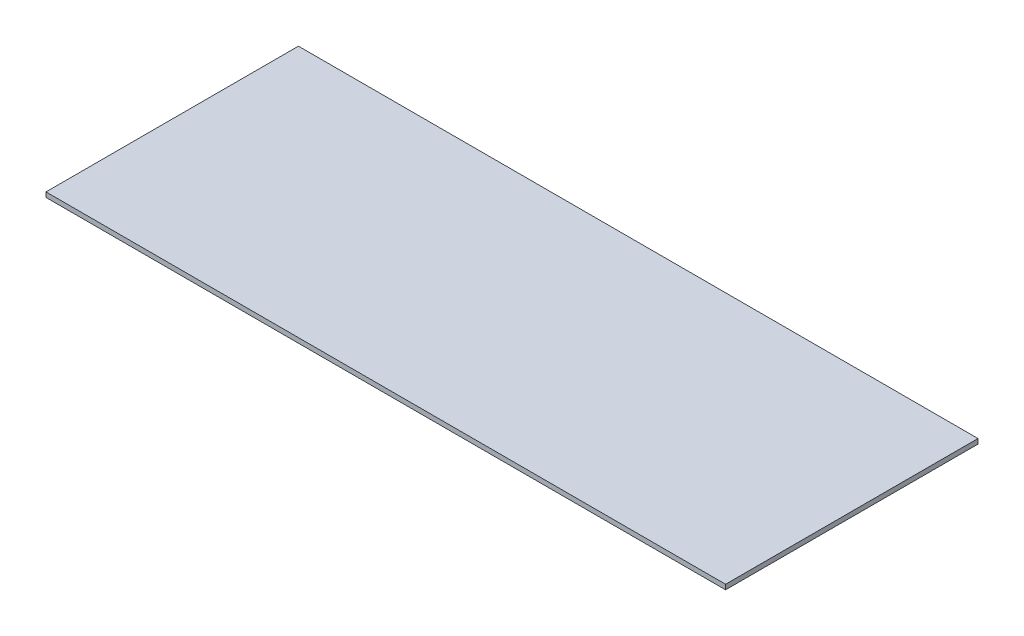
from build123d import *

# Parameters (mm, degrees)
SKETCH1_W           = 444.5
SKETCH1_H           = 165.1
BOSS_EXTRUDE1_DEPTH = 3.175


with BuildPart() as part:
    # Sketch1 → Boss-Extrude1 (new body)
    with BuildSketch(Plane(origin=(0, 0, 0), x_dir=(1, 0, 0), z_dir=(0, 1, 0))):
        Rectangle(SKETCH1_W, SKETCH1_H)
    extrude(amount=BOSS_EXTRUDE1_DEPTH)


solid = part.part
